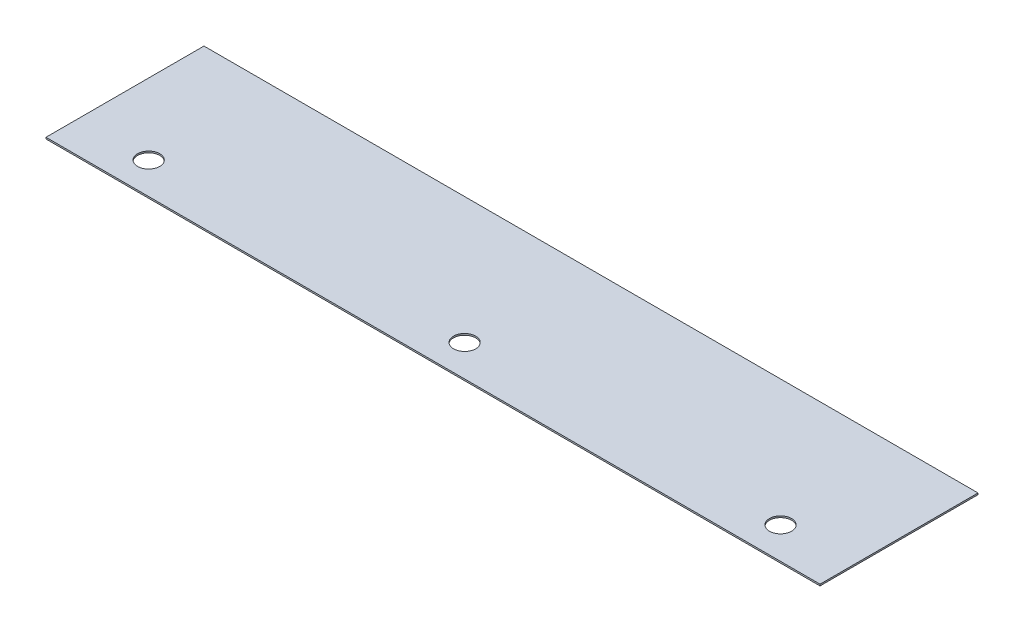
from build123d import *

# Parameters (mm, degrees)
SKETCH1_W            = 245
SKETCH1_H            = 50
BASE_FLANGE1_DEPTH   = 0.5
SKETCH6_R            = 3.5
CUT_EXTRUDE1_DEPTH   = 10
LPATTERN1_COUNT      = 6
LPATTERN1_PITCH      = 146
LPATTERN1_COUNT_DIR2 = 6
LPATTERN1_PITCH_DIR2 = 146
LPATTERN2_COUNT      = 2
LPATTERN2_PITCH      = 100
LPATTERN2_COL_COUNT  = 2
LPATTERN2_COL_PITCH  = 100


# Sheet-metal steps are written as plain solids
with BuildPart() as part:
    # Sketch1 → Base-Flange1 (new body)
    with BuildSketch(Plane(origin=(0, 0, 0), x_dir=(1, 0, 0), z_dir=(0, 1, 0))):
        Rectangle(SKETCH1_W, SKETCH1_H)
    extrude(amount=-BASE_FLANGE1_DEPTH)

    # Sketch6 → Cut-Extrude1 (cut)
    with BuildSketch(Plane(origin=(0, 0, 0), x_dir=(1, 0, 0), z_dir=(0, 1, 0))):
        with Locations(Location((0, -15, 0), (0, 0, 270))):
            Circle(SKETCH6_R)
    cut_extrude1 = extrude(amount=-CUT_EXTRUDE1_DEPTH, mode=Mode.SUBTRACT)

    # LPattern1: Cut-Extrude1 6 × 6
    with Locations(*[Vector(-1, 0, 0) * (i * LPATTERN1_PITCH) + Vector(1, 0, 0) * (j * LPATTERN1_PITCH_DIR2) for i in range(LPATTERN1_COUNT) for j in range(LPATTERN1_COUNT_DIR2) if (i, j) != (0, 0)]):
        add(cut_extrude1, mode=Mode.SUBTRACT)

    # LPattern2: Cut-Extrude1 ×2
    with Locations(*[(-i * LPATTERN2_PITCH, 0, 0) for i in range(1, LPATTERN2_COUNT)]):
        add(cut_extrude1, mode=Mode.SUBTRACT)

    # LPattern2 col: Cut-Extrude1 ×2
    with Locations(*[(i * LPATTERN2_COL_PITCH, 0, 0) for i in range(1, LPATTERN2_COL_COUNT)]):
        add(cut_extrude1, mode=Mode.SUBTRACT)


solid = part.part
